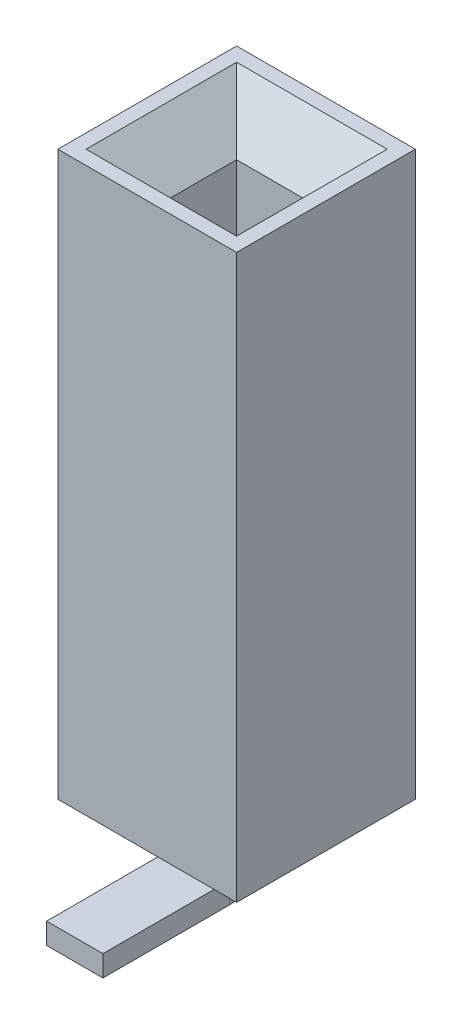
from build123d import *

# Parameters (mm, degrees)
SKETCH1_W           = 2.54
SKETCH1_H           = 2.54
BOSS_EXTRUDE1_DEPTH = 8
SKETCH2_W           = 0.94
SKETCH2_H           = 0.94
CUT_EXTRUDE1_DEPTH  = 7
CHAMFER1_SIZE       = 0.6
SKETCH3_W           = 0.8
SKETCH3_H           = 0.3


with BuildPart() as part:
    # Sketch1 → Boss-Extrude1 (new body)
    with BuildSketch(Plane(origin=(0, 0, 0), x_dir=(1, 0, 0), z_dir=(0, 1, 0))):
        Rectangle(SKETCH1_W, SKETCH1_H)
    extrude(amount=BOSS_EXTRUDE1_DEPTH)

    # Sketch2 → Cut-Extrude1 (cut)
    with BuildSketch(Plane(origin=(0, 8, 0), x_dir=(1, 0, 0), z_dir=(0, 1, 0))):
        Rectangle(SKETCH2_W, SKETCH2_H)
    extrude(amount=-CUT_EXTRUDE1_DEPTH, mode=Mode.SUBTRACT)

    # Chamfer1
    chamfer1_edges = [part.edges().sort_by_distance(p)[0] for p in [
        (0.47, 8, 0),
        (0, 8, 0.47),
        (-0.47, 8, 0),
        (0, 8, -0.47),
    ]]
    chamfer(chamfer1_edges, length=CHAMFER1_SIZE)

    # Sweep1: sweep along a path in Sketch4
    with BuildLine(Plane.ZY) as sweep1_path:
        Line((0, 0), (0, -0.2))
        ThreePointArc((0, -0.2), (0.146446609, -0.553553391), (0.5, -0.7))
        Line((0.5, -0.7), (2.3, -0.7))
    # Sketch3 → Sweep1 (sweep)
    with BuildSketch(Plane.XZ):
        Rectangle(SKETCH3_W, SKETCH3_H)
    sweep(path=sweep1_path.line)


solid = part.part
